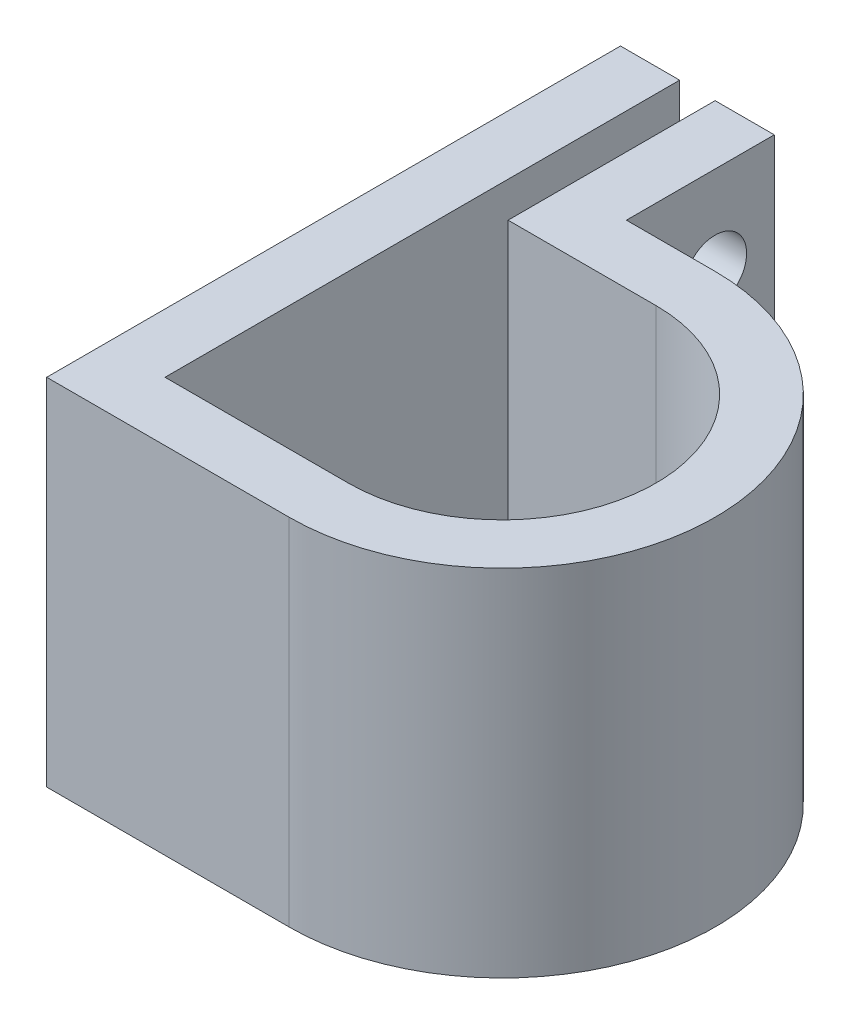
from build123d import *

# Parameters (mm, degrees)
BOSS_EXTRUDE1_DEPTH = 38.1
SKETCH2_R           = 3.3782
CUT_EXTRUDE1_DEPTH  = 64.25186519


with BuildPart() as part:
    # Sketch1 → Boss-Extrude1 (new body)
    with BuildSketch(Plane(origin=(0, 0, 0), x_dir=(1, 0, 0), z_dir=(0, 1, 0))):
        with BuildLine():
            Line((0, -16.51), (-19.685, -16.51))
            Line((-19.685, -16.51), (-19.685, 38.735))
            Line((-19.685, 38.735), (-26.035, 38.735))
            Line((-26.035, 38.735), (-26.035, -22.86))
            Line((-26.035, -22.86), (0, -22.86))
            ThreePointArc((0, -22.86), (22.86, 0), (0, 22.86))
            Line((0, 22.86), (-9.525, 22.86))
            Line((-9.525, 22.86), (-9.525, 38.735))
            Line((-9.525, 38.735), (-15.875, 38.735))
            Line((-15.875, 38.735), (-15.875, 16.51))
            Line((-15.875, 16.51), (0, 16.51))
            ThreePointArc((0, 16.51), (16.51, 0), (0, -16.51))
        make_face()
    extrude(amount=BOSS_EXTRUDE1_DEPTH)

    # Sketch2 → Cut-Extrude1 (cut, through all)
    with BuildSketch(Plane(origin=(-9.525, 0, 0), x_dir=(0, 0, -1), z_dir=(1, 0, 0))):
        with Locations((32.385, 28.575)):
            Circle(SKETCH2_R)
        with Locations((32.385, 9.525)):
            Circle(SKETCH2_R)
    extrude(amount=-CUT_EXTRUDE1_DEPTH, mode=Mode.SUBTRACT)


solid = part.part
